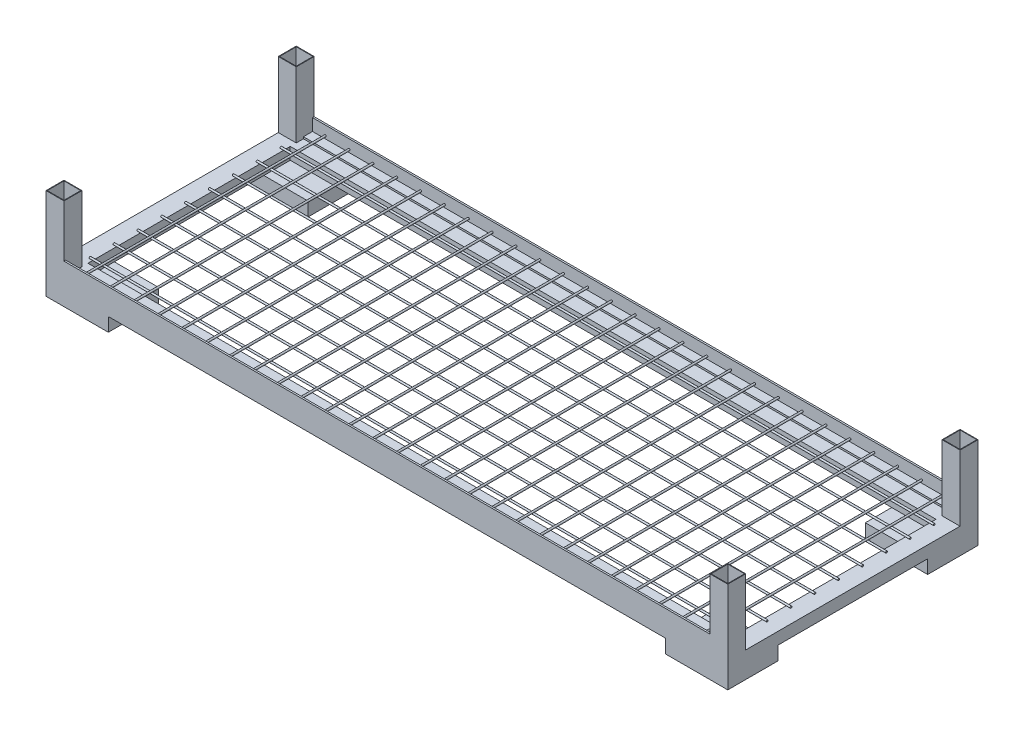
from build123d import *

# Parameters (mm, degrees)
SKETCH1_W             = 1444.625
SKETCH1_H             = 530.225
SKETCH1_W_2           = 1368.425
SKETCH1_H_2           = 428.625
BOSS_EXTRUDE1_DEPTH   = 25.4
SKETCH2_W             = 38.1
SKETCH2_H             = 38.1
SKETCH2_W_2           = 35.56
SKETCH2_H_2           = 35.56
BOSS_EXTRUDE2_DEPTH   = 139.7
SKETCH3_W             = 1368.425
SKETCH3_H             = 22.86
BOSS_EXTRUDE3_DEPTH   = 3.81
SKETCH4_R             = 1.905
BOSS_EXTRUDE4_DEPTH   = 1384.3
BOSS_EXTRUDE4_2_DEPTH = 1384.3
BOSS_EXTRUDE4_3_DEPTH = 1384.3
BOSS_EXTRUDE4_4_DEPTH = 1384.3
BOSS_EXTRUDE4_5_DEPTH = 1384.3
BOSS_EXTRUDE4_6_DEPTH = 1384.3
BOSS_EXTRUDE4_7_DEPTH = 1384.3
BOSS_EXTRUDE4_8_DEPTH = 1384.3
BOSS_EXTRUDE4_9_DEPTH = 1384.3
SKETCH5_W             = 1368.425
SKETCH5_H             = 3.556
BOSS_EXTRUDE5_DEPTH   = 25.4
SKETCH6_R             = 1.905
BOSS_EXTRUDE6_DEPTH   = 523.113
SKETCH7_W             = 132.08
SKETCH7_H             = 106.68
BOSS_EXTRUDE7_DEPTH   = 3.556
SKETCH8_W             = 132.08
SKETCH8_H             = 106.68
SKETCH8_W_2           = 124.968
SKETCH8_H_2           = 99.568
BOSS_EXTRUDE8_DEPTH   = 25.4
SKETCH9_W             = 35.56
SKETCH9_H             = 35.56
CUT_EXTRUDE1_DEPTH    = 22.606


with BuildPart() as part:
    # Sketch1 → Boss-Extrude1 (new body)
    with BuildSketch(Plane(origin=(0, 0, 0), x_dir=(1, 0, 0), z_dir=(0, 1, 0))):
        Rectangle(SKETCH1_W, SKETCH1_H)
        Rectangle(SKETCH1_W_2, SKETCH1_H_2, mode=Mode.SUBTRACT)
    extrude(amount=BOSS_EXTRUDE1_DEPTH)

    # Sketch2 → Boss-Extrude2 (add)
    # profile 1 of 4: a face of its own
    with BuildSketch(Plane(origin=(0, 25.4, 0), x_dir=(1, 0, 0), z_dir=(0, 1, 0))):
        with Locations((-703.2625, 246.0625)):
            Rectangle(SKETCH2_W, SKETCH2_H)
        with Locations((-703.2625, 246.0625)):
            Rectangle(SKETCH2_W_2, SKETCH2_H_2, mode=Mode.SUBTRACT)
    # profile 2 of 4: a face of its own
    with BuildSketch(Plane(origin=(0, 25.4, 0), x_dir=(1, 0, 0), z_dir=(0, 1, 0))):
        with Locations((-703.2625, -246.0625)):
            Rectangle(SKETCH2_W, SKETCH2_H)
        with Locations((-703.2625, -246.0625)):
            Rectangle(SKETCH2_W_2, SKETCH2_H_2, mode=Mode.SUBTRACT)
    # profile 3 of 4: a face of its own
    with BuildSketch(Plane(origin=(0, 25.4, 0), x_dir=(1, 0, 0), z_dir=(0, 1, 0))):
        with Locations((703.2625, -246.0625)):
            Rectangle(SKETCH2_W, SKETCH2_H)
        with Locations((703.2625, -246.0625)):
            Rectangle(SKETCH2_W_2, SKETCH2_H_2, mode=Mode.SUBTRACT)
    # profile 4 of 4: a face of its own
    with BuildSketch(Plane(origin=(0, 25.4, 0), x_dir=(1, 0, 0), z_dir=(0, 1, 0))):
        with Locations((703.2625, 246.0625)):
            Rectangle(SKETCH2_W, SKETCH2_H)
        with Locations((703.2625, 246.0625)):
            Rectangle(SKETCH2_W_2, SKETCH2_H_2, mode=Mode.SUBTRACT)
    extrude(amount=BOSS_EXTRUDE2_DEPTH)

    # Sketch3 → Boss-Extrude3 (add)
    with BuildSketch(Plane(origin=(0, 25.4, 0), x_dir=(1, 0, 0), z_dir=(0, 1, 0))):
        with Locations((0, 253.6825)):
            Rectangle(SKETCH3_W, SKETCH3_H)
        with Locations((0, -253.6825)):
            Rectangle(SKETCH3_W, SKETCH3_H)
    extrude(amount=BOSS_EXTRUDE3_DEPTH)

    # Sketch5 → Boss-Extrude5 (add)
    with BuildSketch(Plane(origin=(0, 29.21, 0), x_dir=(1, 0, 0), z_dir=(0, 1, 0))):
        with Locations((0, -263.3345)):
            Rectangle(SKETCH5_W, SKETCH5_H)
        with Locations((0, 263.3345)):
            Rectangle(SKETCH5_W, SKETCH5_H)
    extrude(amount=BOSS_EXTRUDE5_DEPTH)

    # Sketch6 → Boss-Extrude6 (add)
    with BuildSketch(Plane(origin=(0, 0, 261.5565), x_dir=(-1, 0, 0), z_dir=(0, 0, -1))):
        with Locations((0, 34.925)):
            Circle(SKETCH6_R)
        with Locations((50.546, 34.925)):
            Circle(SKETCH6_R)
        with Locations((101.092, 34.925)):
            Circle(SKETCH6_R)
        with Locations((151.638, 34.925)):
            Circle(SKETCH6_R)
        with Locations((202.184, 34.925)):
            Circle(SKETCH6_R)
        with Locations((252.73, 34.925)):
            Circle(SKETCH6_R)
        with Locations((303.276, 34.925)):
            Circle(SKETCH6_R)
        with Locations((353.822, 34.925)):
            Circle(SKETCH6_R)
        with Locations((404.368, 34.925)):
            Circle(SKETCH6_R)
        with Locations((454.914, 34.925)):
            Circle(SKETCH6_R)
        with Locations((505.46, 34.925)):
            Circle(SKETCH6_R)
        with Locations((556.006, 34.925)):
            Circle(SKETCH6_R)
        with Locations((606.552, 34.925)):
            Circle(SKETCH6_R)
        with Locations((657.098, 34.925)):
            Circle(SKETCH6_R)
        with Locations((-50.546, 34.925)):
            Circle(SKETCH6_R)
        with Locations((-101.092, 34.925)):
            Circle(SKETCH6_R)
        with Locations((-151.638, 34.925)):
            Circle(SKETCH6_R)
        with Locations((-202.184, 34.925)):
            Circle(SKETCH6_R)
        with Locations((-252.73, 34.925)):
            Circle(SKETCH6_R)
        with Locations((-303.276, 34.925)):
            Circle(SKETCH6_R)
        with Locations((-353.822, 34.925)):
            Circle(SKETCH6_R)
        with Locations((-404.368, 34.925)):
            Circle(SKETCH6_R)
        with Locations((-454.914, 34.925)):
            Circle(SKETCH6_R)
        with Locations((-505.46, 34.925)):
            Circle(SKETCH6_R)
        with Locations((-556.006, 34.925)):
            Circle(SKETCH6_R)
        with Locations((-606.552, 34.925)):
            Circle(SKETCH6_R)
        with Locations((-657.098, 34.925)):
            Circle(SKETCH6_R)
    extrude(amount=BOSS_EXTRUDE6_DEPTH)

    # Sketch7 → Boss-Extrude7 (add)
    with BuildSketch(Plane.XZ):
        with Locations((-656.2725, -211.7725)):
            Rectangle(SKETCH7_W, SKETCH7_H)
        with Locations((-656.2725, 211.7725)):
            Rectangle(SKETCH7_W, SKETCH7_H)
        with Locations((656.2725, -211.7725)):
            Rectangle(SKETCH7_W, SKETCH7_H)
        with Locations((656.2725, 211.7725)):
            Rectangle(SKETCH7_W, SKETCH7_H)
    extrude(amount=BOSS_EXTRUDE7_DEPTH)

    # Sketch8 → Boss-Extrude8 (add)
    # profile 1 of 4: a face of its own
    with BuildSketch(Plane.XZ.offset(3.556)):
        with Locations((-656.2725, -211.7725)):
            Rectangle(SKETCH8_W, SKETCH8_H)
        with Locations((-656.2725, -211.7725)):
            Rectangle(SKETCH8_W_2, SKETCH8_H_2, mode=Mode.SUBTRACT)
    # profile 2 of 4: a face of its own
    with BuildSketch(Plane.XZ.offset(3.556)):
        with Locations((-656.2725, 211.7725)):
            Rectangle(SKETCH8_W, SKETCH8_H)
        with Locations((-656.2725, 211.7725)):
            Rectangle(SKETCH8_W_2, SKETCH8_H_2, mode=Mode.SUBTRACT)
    # profile 3 of 4: a face of its own
    with BuildSketch(Plane.XZ.offset(3.556)):
        with Locations((656.2725, 211.7725)):
            Rectangle(SKETCH8_W, SKETCH8_H)
        with Locations((656.2725, 211.7725)):
            Rectangle(SKETCH8_W_2, SKETCH8_H_2, mode=Mode.SUBTRACT)
    # profile 4 of 4: a face of its own
    with BuildSketch(Plane.XZ.offset(3.556)):
        with Locations((656.2725, -211.7725)):
            Rectangle(SKETCH8_W, SKETCH8_H)
        with Locations((656.2725, -211.7725)):
            Rectangle(SKETCH8_W_2, SKETCH8_H_2, mode=Mode.SUBTRACT)
    extrude(amount=BOSS_EXTRUDE8_DEPTH)

    # Sketch9 → Cut-Extrude1 (cut)
    with BuildSketch(Plane(origin=(0, 25.4, 0), x_dir=(1, 0, 0), z_dir=(0, 1, 0))):
        with Locations((-703.2625, 246.0625)):
            Rectangle(SKETCH9_W, SKETCH9_H)
        with Locations((-703.2625, -246.0625)):
            Rectangle(SKETCH9_W, SKETCH9_H)
        with Locations((703.2625, -246.0625)):
            Rectangle(SKETCH9_W, SKETCH9_H)
        with Locations((703.2625, 246.0625)):
            Rectangle(SKETCH9_W, SKETCH9_H)
    extrude(amount=-CUT_EXTRUDE1_DEPTH, mode=Mode.SUBTRACT)


with BuildPart() as body_2:
    # Sketch4 → Boss-Extrude4 (new body)
    with BuildSketch(Plane(origin=(-690.5625, 0, 0), x_dir=(0, 0, -1), z_dir=(1, 0, 0))):
        with Locations((-1.318131718, 27.305)):
            Circle(SKETCH4_R)
    extrude(amount=BOSS_EXTRUDE4_DEPTH)


with BuildPart() as body_3:
    # Sketch4 → Boss-Extrude4 2 (new body)
    with BuildSketch(Plane(origin=(-690.5625, 0, 0), x_dir=(0, 0, -1), z_dir=(1, 0, 0))):
        with Locations((49.227868282, 27.305)):
            Circle(SKETCH4_R)
    extrude(amount=BOSS_EXTRUDE4_2_DEPTH)


with BuildPart() as body_4:
    # Sketch4 → Boss-Extrude4 3 (new body)
    with BuildSketch(Plane(origin=(-690.5625, 0, 0), x_dir=(0, 0, -1), z_dir=(1, 0, 0))):
        with Locations((99.773868282, 27.305)):
            Circle(SKETCH4_R)
    extrude(amount=BOSS_EXTRUDE4_3_DEPTH)


with BuildPart() as body_5:
    # Sketch4 → Boss-Extrude4 4 (new body)
    with BuildSketch(Plane(origin=(-690.5625, 0, 0), x_dir=(0, 0, -1), z_dir=(1, 0, 0))):
        with Locations((150.319868282, 27.305)):
            Circle(SKETCH4_R)
    extrude(amount=BOSS_EXTRUDE4_4_DEPTH)


with BuildPart() as body_6:
    # Sketch4 → Boss-Extrude4 5 (new body)
    with BuildSketch(Plane(origin=(-690.5625, 0, 0), x_dir=(0, 0, -1), z_dir=(1, 0, 0))):
        with Locations((200.865868282, 27.305)):
            Circle(SKETCH4_R)
    extrude(amount=BOSS_EXTRUDE4_5_DEPTH)


with BuildPart() as body_7:
    # Sketch4 → Boss-Extrude4 6 (new body)
    with BuildSketch(Plane(origin=(-690.5625, 0, 0), x_dir=(0, 0, -1), z_dir=(1, 0, 0))):
        with Locations((-51.864131718, 27.305)):
            Circle(SKETCH4_R)
    extrude(amount=BOSS_EXTRUDE4_6_DEPTH)


with BuildPart() as body_8:
    # Sketch4 → Boss-Extrude4 7 (new body)
    with BuildSketch(Plane(origin=(-690.5625, 0, 0), x_dir=(0, 0, -1), z_dir=(1, 0, 0))):
        with Locations((-102.410131718, 27.305)):
            Circle(SKETCH4_R)
    extrude(amount=BOSS_EXTRUDE4_7_DEPTH)


with BuildPart() as body_9:
    # Sketch4 → Boss-Extrude4 8 (new body)
    with BuildSketch(Plane(origin=(-690.5625, 0, 0), x_dir=(0, 0, -1), z_dir=(1, 0, 0))):
        with Locations((-152.956131718, 27.305)):
            Circle(SKETCH4_R)
    extrude(amount=BOSS_EXTRUDE4_8_DEPTH)


with BuildPart() as body_10:
    # Sketch4 → Boss-Extrude4 9 (new body)
    with BuildSketch(Plane(origin=(-690.5625, 0, 0), x_dir=(0, 0, -1), z_dir=(1, 0, 0))):
        with Locations((-203.502131718, 27.305)):
            Circle(SKETCH4_R)
    extrude(amount=BOSS_EXTRUDE4_9_DEPTH)


solid = Compound([part.part, body_2.part, body_3.part, body_4.part, body_5.part, body_6.part, body_7.part, body_8.part, body_9.part, body_10.part])
